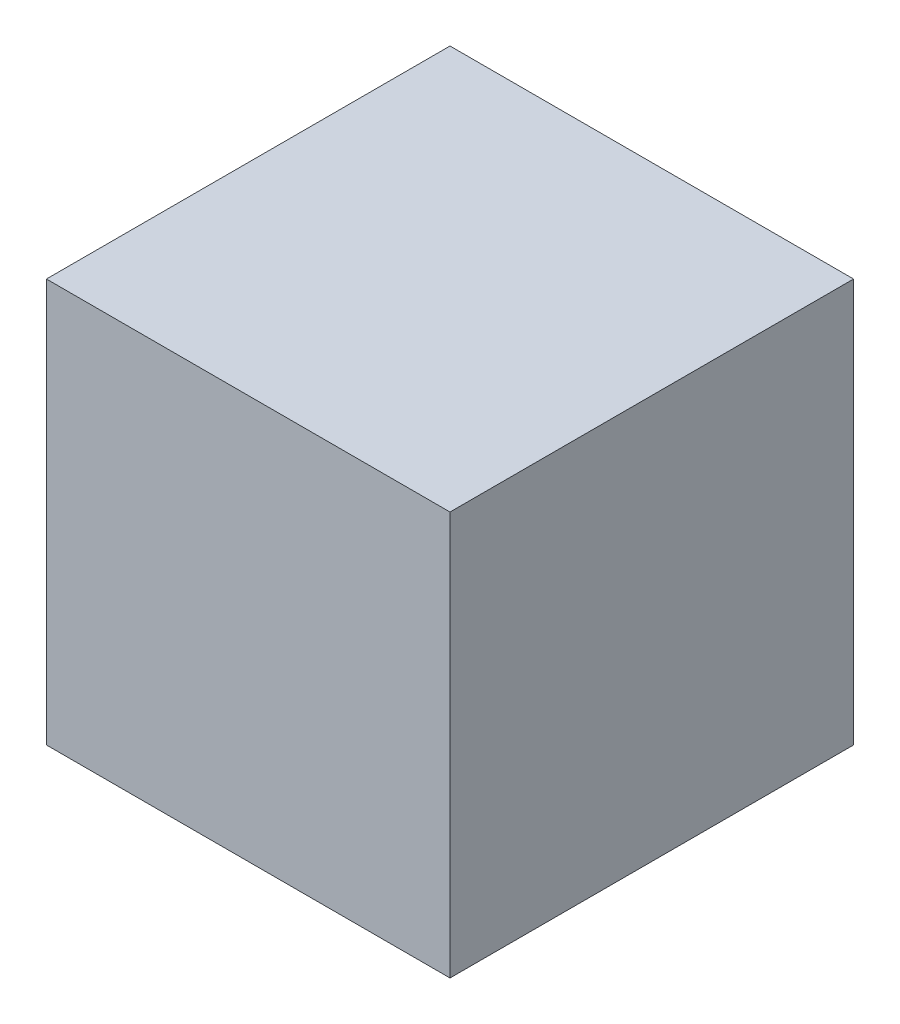
from build123d import *

# Parameters (mm, degrees)
SKETCH1_W           = 254
SKETCH1_H           = 254
BOSS_EXTRUDE1_DEPTH = 127


with BuildPart() as part:
    # Sketch1 → Boss-Extrude1 (new, symmetric)
    with BuildSketch(Plane.XY):
        Rectangle(SKETCH1_W, SKETCH1_H)
    extrude(amount=BOSS_EXTRUDE1_DEPTH, both=True)


solid = part.part
